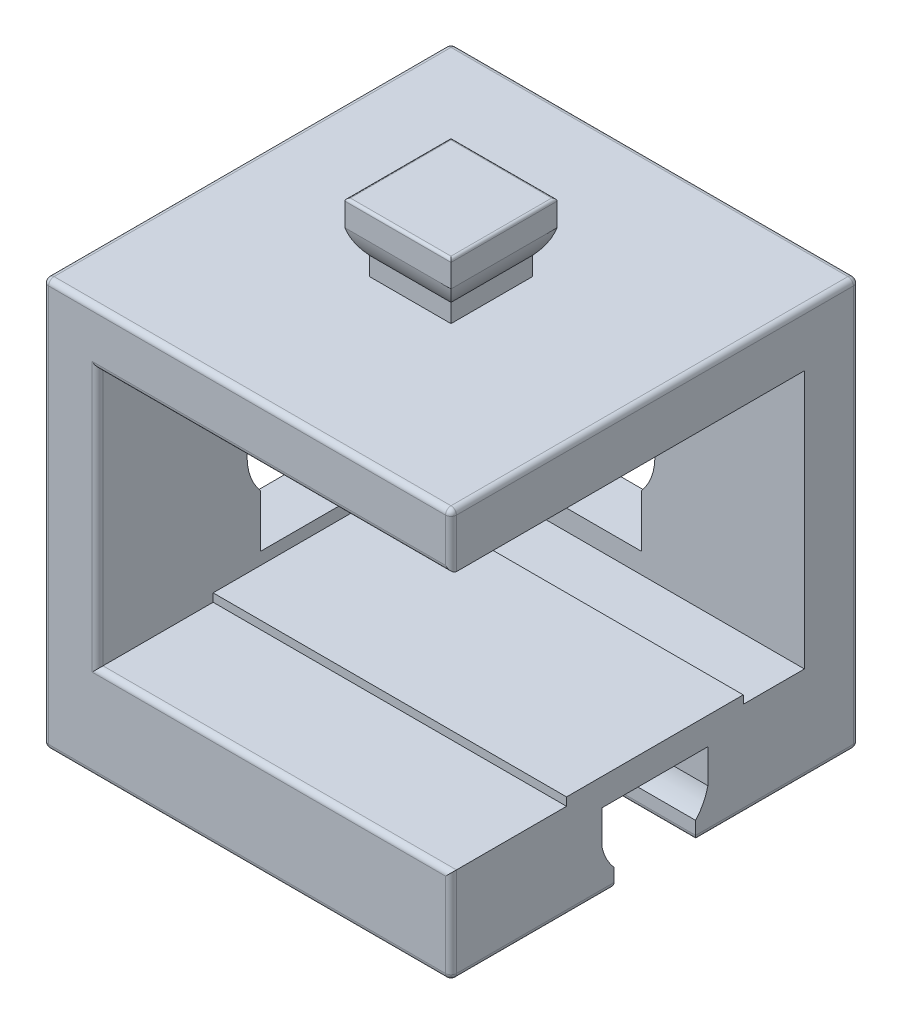
from build123d import *

# Parameters (mm, degrees)
EXTRUDE_1_DEPTH      = 7.5
EXTRUDE_1_DEPTH_BACK = 7.5
SKETCH_1_W           = 15
SKETCH_1_H           = 15
SKETCH_2_W           = 13
SKETCH_2_H           = 9.5
CUT_EXTRUDE_1_DEPTH  = 13
SKETCH_3_W           = 3
SKETCH_3_H           = 3
EXTRUDE_2_DEPTH      = 1
EXTRUDE_3_DEPTH      = 2
EXTRUDE_3_DEPTH_BACK = 2
CUT_EXTRUDE_2_REACH  = 23.256
EXTRUDE_4_REACH      = 26.238
SKETCH_6_W           = 6.5
SKETCH_6_H           = 0.3
CUT_EXTRUDE_3_DEPTH  = 9.45
CUT_EXTRUDE_4_REACH  = 25.054
CUT_EXTRUDE_5_REACH  = 25.054
FILLET_1_R           = 0.1
FILLET_2_R           = 0.2


with BuildPart() as part:
    # 草图1 → 凸台-拉伸1 (new, two sides: drawn at the far end of the back side and taken through both)
    with BuildSketch(Plane.XY.offset(-EXTRUDE_1_DEPTH_BACK)):
        with Locations((0, 7.5)):
            Rectangle(SKETCH_1_W, SKETCH_1_H)
    extrude(amount=EXTRUDE_1_DEPTH + EXTRUDE_1_DEPTH_BACK)

    # 草图2 → 切除-拉伸1 (cut)
    with BuildSketch(Plane.XY.offset(7.5)):
        with Locations((1, 8.25)):
            Rectangle(SKETCH_2_W, SKETCH_2_H)
    extrude(amount=-CUT_EXTRUDE_1_DEPTH, mode=Mode.SUBTRACT)

    # 草图3 → 凸台-拉伸2 (add)
    with BuildSketch(Plane(origin=(0, 15, 0), x_dir=(-1, 0, 0), z_dir=(0, 1, 0))):
        Rectangle(SKETCH_3_W, SKETCH_3_H)
    extrude(amount=EXTRUDE_2_DEPTH)

    # 草图4 → 凸台-拉伸3 (add, two sides: drawn at the far end of the back side and taken through both)
    with BuildSketch(Plane.XY.offset(-EXTRUDE_3_DEPTH_BACK)):
        with BuildLine():
            Line((-1.95, 17.5), (-1.95, 16.555590279))
            ThreePointArc((-1.95, 16.555590279), (-1.780042303, 16.088161527), (-1.5, 15.677124344))
            Line((-1.5, 15.677124344), (1.5, 15.677124344))
            ThreePointArc((1.5, 15.677124344), (1.780042303, 16.088161527), (1.95, 16.555590279))
            Line((1.95, 16.555590279), (1.95, 17.5))
            Line((1.95, 17.5), (-1.95, 17.5))
        make_face()
    extrude(amount=EXTRUDE_3_DEPTH + EXTRUDE_3_DEPTH_BACK)

    # 草图5 → 切除-拉伸2 (cut, up to next)
    with BuildSketch(Plane.ZY.offset(1.95), mode=Mode.PRIVATE) as cut_extrude_2_sk1:
        with BuildLine():
            Line((-1.95, 17.5), (-1.95, 16.555590279))
            ThreePointArc((-1.95, 16.555590279), (-1.780042303, 16.088161527), (-1.5, 15.677124344))
            Line((-1.5, 15.677124344), (-2, 15.677124344))
            Line((-2, 15.677124344), (-2, 17.5))
            Line((-2, 17.5), (-1.95, 17.5))
        make_face()
    cut_extrude_2_tool1 = extrude(cut_extrude_2_sk1.sketch, amount=-CUT_EXTRUDE_2_REACH, mode=Mode.PRIVATE) & part.part
    # 草图5 → 切除-拉伸2 (cut, up to next)
    with BuildSketch(Plane.ZY.offset(1.95), mode=Mode.PRIVATE) as cut_extrude_2_sk2:
        with BuildLine():
            Line((2, 17.5), (2, 15.677124344))
            Line((2, 15.677124344), (1.5, 15.677124344))
            ThreePointArc((1.5, 15.677124344), (1.780042303, 16.088161527), (1.95, 16.555590279))
            Line((1.95, 16.555590279), (1.95, 17.5))
            Line((1.95, 17.5), (2, 17.5))
        make_face()
    cut_extrude_2_tool2 = extrude(cut_extrude_2_sk2.sketch, amount=-CUT_EXTRUDE_2_REACH, mode=Mode.PRIVATE) & part.part
    add(cut_extrude_2_tool1.solids().sort_by_distance((-1.95, 16.175075, -1.873038))[0], mode=Mode.SUBTRACT)
    add(cut_extrude_2_tool2.solids().sort_by_distance((-1.95, 16.175075, 1.873038))[0], mode=Mode.SUBTRACT)

    # 草图6 → 凸台-拉伸4 (add, up to next)
    with BuildSketch(Plane(origin=(7.5, 0, 0), x_dir=(0, 0, -1), z_dir=(1, 0, 0)), mode=Mode.PRIVATE) as extrude_4_sk1:
        with Locations((0, 3.65)):
            Rectangle(SKETCH_6_W, SKETCH_6_H)
    extrude_4_tool1 = extrude(extrude_4_sk1.sketch, amount=-EXTRUDE_4_REACH, mode=Mode.PRIVATE) - part.part
    add(extrude_4_tool1.solids().sort_by_distance((7.5, 3.65, 0))[0])

    # 草图7 → 切除-拉伸3 (cut)
    with BuildSketch(Plane(origin=(7.5, 0, 0), x_dir=(0, 0, -1), z_dir=(1, 0, 0))):
        with BuildLine():
            Line((-1.5, 0), (1.5, 0))
            Line((1.5, 0), (1.5, 0.677124344))
            ThreePointArc((1.5, 0.677124344), (1.780042303, 1.088161527), (1.95, 1.555590279))
            Line((1.95, 1.555590279), (1.95, 2.8))
            Line((1.95, 2.8), (-1.95, 2.8))
            Line((-1.95, 2.8), (-1.95, 1.555590279))
            ThreePointArc((-1.95, 1.555590279), (-1.780042303, 1.088161527), (-1.5, 0.677124344))
            Line((-1.5, 0.677124344), (-1.5, 0))
        make_face()
    extrude(amount=-CUT_EXTRUDE_3_DEPTH, mode=Mode.SUBTRACT)

    # 草图8 → 切除-拉伸4 (cut, up to next)
    with BuildSketch(Plane.XY.offset(-5.5), mode=Mode.PRIVATE) as cut_extrude_4_sk1:
        with BuildLine():
            Line((-1.5, 8.822875656), (-1.5, 10.75))
            Line((-1.5, 10.75), (1.5, 10.75))
            Line((1.5, 10.75), (1.5, 8.822875656))
            ThreePointArc((1.5, 8.822875656), (2, 7.5), (1.5, 6.177124344))
            Line((1.5, 6.177124344), (1.5, 4.25))
            Line((1.5, 4.25), (-1.5, 4.25))
            Line((-1.5, 4.25), (-1.5, 6.177124344))
            ThreePointArc((-1.5, 6.177124344), (-2, 7.5), (-1.5, 8.822875656))
        make_face()
    cut_extrude_4_tool1 = extrude(cut_extrude_4_sk1.sketch, amount=-CUT_EXTRUDE_4_REACH, mode=Mode.PRIVATE) & part.part
    add(cut_extrude_4_tool1.solids().sort_by_distance((0, 7.5, -5.5))[0], mode=Mode.SUBTRACT)

    # 草图9 → 切除-拉伸5 (cut, up to next)
    with BuildSketch(Plane(origin=(-5.5, 0, 0), x_dir=(0, 0, -1), z_dir=(1, 0, 0)), mode=Mode.PRIVATE) as cut_extrude_5_sk1:
        with BuildLine():
            Line((-1.5, 8.822875656), (-1.5, 10.75))
            Line((-1.5, 10.75), (1.5, 10.75))
            Line((1.5, 10.75), (1.5, 8.822875656))
            ThreePointArc((1.5, 8.822875656), (2, 7.5), (1.5, 6.177124344))
            Line((1.5, 6.177124344), (1.5, 4.25))
            Line((1.5, 4.25), (-1.5, 4.25))
            Line((-1.5, 4.25), (-1.5, 6.177124344))
            ThreePointArc((-1.5, 6.177124344), (-2, 7.5), (-1.5, 8.822875656))
        make_face()
    cut_extrude_5_tool1 = extrude(cut_extrude_5_sk1.sketch, amount=-CUT_EXTRUDE_5_REACH, mode=Mode.PRIVATE) & part.part
    add(cut_extrude_5_tool1.solids().sort_by_distance((-5.5, 7.5, 0))[0], mode=Mode.SUBTRACT)

    # 圆角1
    fillet_1_edges = [part.edges().sort_by_distance(p)[0] for p in [
        (-1.95, 17.5, 0),
        (0, 17.5, -1.95),
        (1.95, 17.5, 0),
        (0, 17.5, 1.95),
    ]]
    fillet(fillet_1_edges, radius=FILLET_1_R)

    # 圆角2
    fillet_2_edges = [part.edges().sort_by_distance(p)[0] for p in [
        (7.5, 0, -4.5),
        (0, 0, -7.5),
        (-7.5, 0, 0),
        (7.5, 0, 4.5),
        (2.775, 0, 1.5),
        (-1.95, 0, 0),
        (2.775, 0, -1.5),
        (1, 3.5, 7.5),
        (7.5, 1.75, 7.5),
        (0, 0, 7.5),
        (-7.5, 7.5, 7.5),
        (0, 15, 7.5),
        (7.5, 14, 7.5),
        (1, 13, 7.5),
        (-5.5, 8.25, 7.5),
        (7.5, 7.5, -7.5),
        (7.5, 15, 0),
        (0, 15, -7.5),
        (-7.5, 15, 0),
        (-7.5, 7.5, -7.5),
    ]]
    fillet(fillet_2_edges, radius=FILLET_2_R)


solid = part.part
